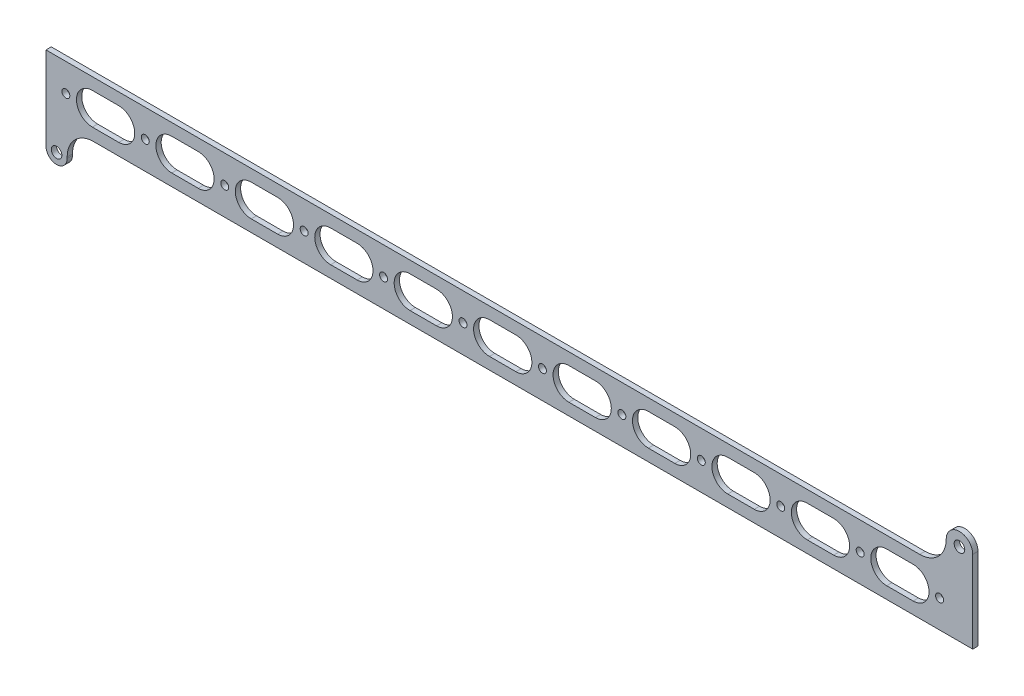
from build123d import *

# Parameters (mm, degrees)
SKETCH_1_W             = 350
SKETCH_1_H             = 21
EXTRUDE_1_DEPTH        = 2
SKETCH_2_R             = 2
EXTRUDE_2_DEPTH        = 2
FILLET_1_R             = 10
SKETCH_3_R             = 1.5
CUT_EXTRUDE_1_DEPTH    = 30
PATTERN_LINEAR_1_COUNT = 10
PATTERN_LINEAR_1_PITCH = 30
SKETCH_4_R             = 1.5
CUT_EXTRUDE_2_DEPTH    = 10
CUT_EXTRUDE_3_DEPTH    = 5
PATTERN_LINEAR_2_COUNT = 11
PATTERN_LINEAR_2_PITCH = 30


with BuildPart() as part:
    # 草图1 → 凸台-拉伸1 (new body)
    with BuildSketch(Plane.XY):
        Rectangle(SKETCH_1_W, SKETCH_1_H)
    extrude(amount=EXTRUDE_1_DEPTH)

    # 草图2 → 凸台-拉伸2 (add)
    # profile 1 of 2: a face of its own
    with BuildSketch(Plane.XY.offset(2)):
        with BuildLine():
            Line((-175, -21), (-175, -10.5))
            Line((-175, -10.5), (-167, -10.5))
            Line((-167, -10.5), (-167, -21))
            ThreePointArc((-167, -21), (-171, -25), (-175, -21))
        make_face()
        with Locations((-171, -21)):
            Circle(SKETCH_2_R, mode=Mode.SUBTRACT)
    # profile 2 of 2: a face of its own
    with BuildSketch(Plane.XY.offset(2)):
        with BuildLine():
            Line((175, 20.5), (175, 10.5))
            Line((175, 10.5), (165, 10.5))
            Line((165, 10.5), (165, 20.5))
            ThreePointArc((165, 20.5), (170, 25.5), (175, 20.5))
        make_face()
        with Locations((170, 20.5)):
            Circle(SKETCH_2_R, mode=Mode.SUBTRACT)
    extrude(amount=-EXTRUDE_2_DEPTH)

    # 圆角1
    fillet_1_edges = [part.edges().sort_by_distance(p)[0] for p in [
        (-167, -10.5, 1),
        (165, 10.5, 1),
    ]]
    fillet(fillet_1_edges, radius=FILLET_1_R - 0.0001)  # a hair under: the kernel refuses the full size

    # 草图3 → 切除-拉伸1 (cut, symmetric)
    with BuildSketch(Plane.XY.offset(2)):
        with Locations((-137.5, 0)):
            Circle(SKETCH_3_R)
    cut_extrude_1 = extrude(amount=CUT_EXTRUDE_1_DEPTH, both=True, mode=Mode.SUBTRACT)

    # 阵列(线性)1: 切除-拉伸1 ×10
    with Locations(*[(i * PATTERN_LINEAR_1_PITCH, 0, 0) for i in range(1, PATTERN_LINEAR_1_COUNT)]):
        add(cut_extrude_1, mode=Mode.SUBTRACT)

    # 草图4 → 切除-拉伸2 (cut)
    with BuildSketch(Plane.XY.offset(2)):
        with Locations((-167.5, 0)):
            Circle(SKETCH_4_R)
        with Locations((162.5, 0)):
            Circle(SKETCH_4_R)
    extrude(amount=-CUT_EXTRUDE_2_DEPTH, mode=Mode.SUBTRACT)

    # 草图5 → 切除-拉伸3 (cut)
    with BuildSketch(Plane.XY.offset(2)):
        with BuildLine():
            Line((-157.5, 6), (-147.5, 6))
            ThreePointArc((-147.5, 6), (-141.5, 0), (-147.5, -6))
            Line((-147.5, -6), (-157.5, -6))
            ThreePointArc((-157.5, -6), (-163.5, 0), (-157.5, 6))
        make_face()
    cut_extrude_3 = extrude(amount=-CUT_EXTRUDE_3_DEPTH, mode=Mode.SUBTRACT)

    # 阵列(线性)2: 切除-拉伸3 ×11
    with Locations(*[(i * PATTERN_LINEAR_2_PITCH, 0, 0) for i in range(1, PATTERN_LINEAR_2_COUNT)]):
        add(cut_extrude_3, mode=Mode.SUBTRACT)


solid = part.part
